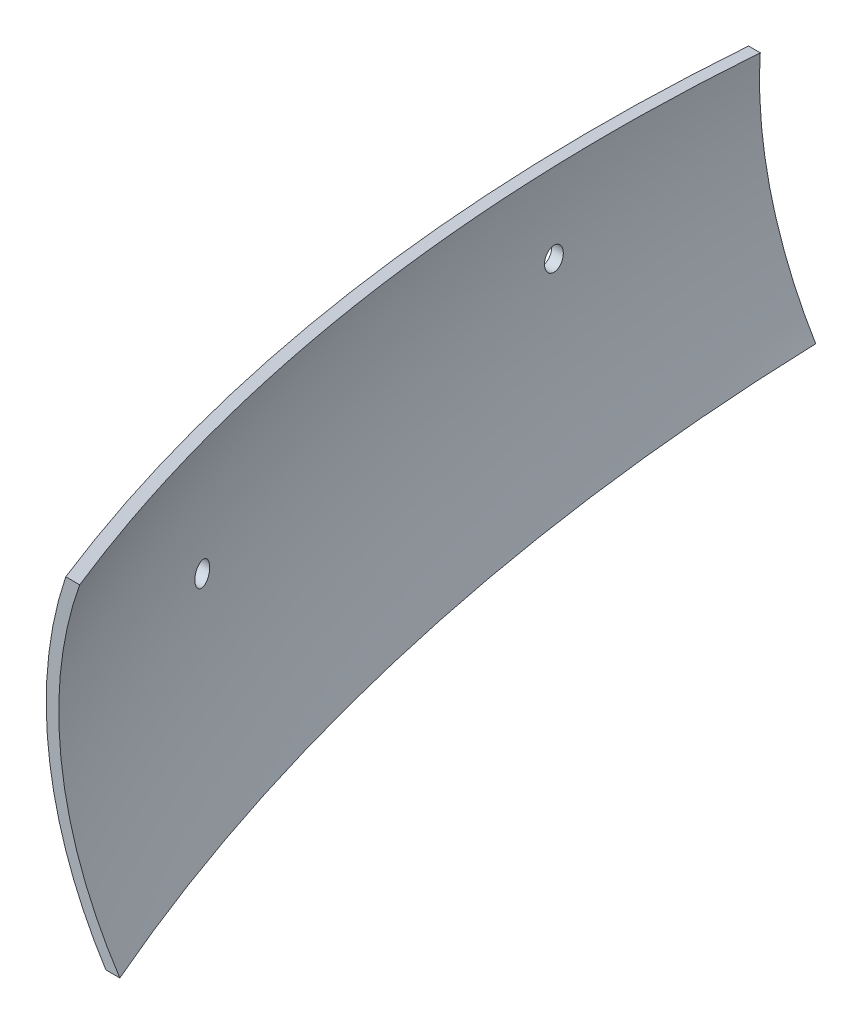
from build123d import *

# Parameters (mm, degrees)
REVOLVE1_ANGLE          = 88
CUT_EXTRUDE2_DEPTH      = 2771.780439466
CUT_EXTRUDE2_DEPTH_BACK = 2771.780439466
SKETCH5_W               = 5800.528681758
SKETCH5_H               = 2435.889164845
CUT_EXTRUDE4_DEPTH      = 838.656303446
CUT_EXTRUDE4_DEPTH_BACK = 838.656303446
SKETCH6_R               = 8.3125


with BuildPart() as part:
    # Sketch2 → Revolve1 (revolve)
    with BuildSketch(Plane.XY):
        with BuildLine():
            Line((72.370392529, 0), (82.370392529, 0))
            ThreePointArc((82.370392529, 0), (40.524594063, 121.838677192), (53.578690935, 250))
            Line((53.578690935, 250), (43.578690935, 250))
            ThreePointArc((43.578690935, 250), (31.595154891, 121.961970263), (72.370392529, 0))
        make_face()
    revolve(axis=Axis((2000, -13.371705106, 0), (0, 1, 0)), revolution_arc=REVOLVE1_ANGLE)

    # Sketch5 → Cut-Extrude2 (cut, two sides: drawn at the far end of the back side and taken through both)
    with BuildSketch(Plane(origin=(0, 0, 0), x_dir=(0, 0, -1), z_dir=(1, 0, 0)).offset(-CUT_EXTRUDE2_DEPTH_BACK)):
        with Locations((76.037885341, -87.116535175)):
            Rectangle(SKETCH5_W, SKETCH5_H)
        Polygon((-762.459239957, 250), (-762.459239957, 0), (-62.459239957, 0), (-62.459239957, 175), align=None, mode=Mode.SUBTRACT)
    extrude(amount=CUT_EXTRUDE2_DEPTH + CUT_EXTRUDE2_DEPTH_BACK, mode=Mode.SUBTRACT)

    # Sketch6 → Cut-Extrude4 (cut, two sides: drawn at the far end of the back side and taken through both)
    with BuildSketch(Plane(origin=(0, 0, 0), x_dir=(0, 0, -1), z_dir=(1, 0, 0)).offset(-CUT_EXTRUDE4_DEPTH_BACK)):
        with Locations((-587.459239957, 130.34)):
            Circle(SKETCH6_R)
        with Locations((-237.459239957, 130.34)):
            Circle(SKETCH6_R)
    extrude(amount=CUT_EXTRUDE4_DEPTH + CUT_EXTRUDE4_DEPTH_BACK, mode=Mode.SUBTRACT)


solid = part.part
